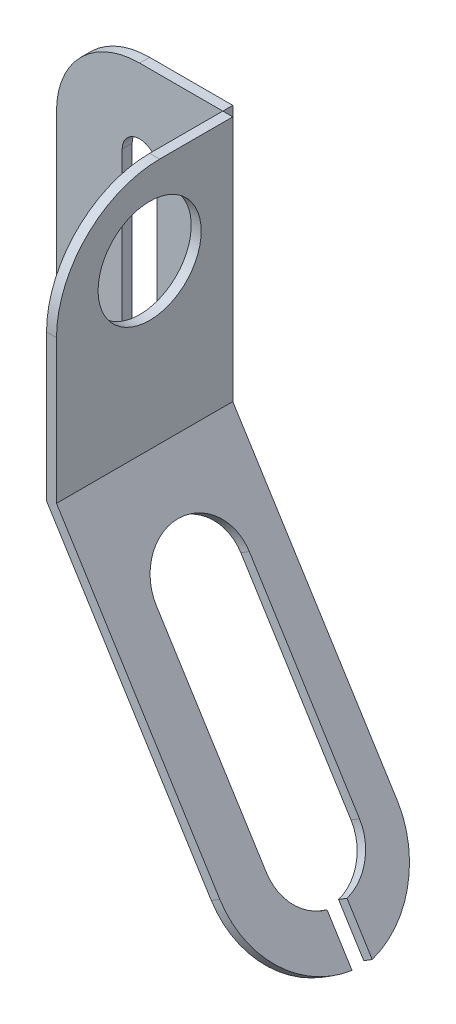
from build123d import *

# Parameters (mm, degrees)
BOSS_EXTRUDE1_DEPTH = 0.06
EXTRUDE_THIN2_DEPTH = 1.06
SKETCH4_R           = 0.31
CUT_EXTRUDE1_DEPTH  = 3.676216217
CUT_EXTRUDE2_DEPTH  = 3.676216217
CUT_EXTRUDE3_START  = -0.06
CUT_EXTRUDE3_DEPTH  = 0.06


# Read off the part's stored shape, not the designer's step: Cut-Extrude3
with BuildPart() as part:
    # Sketch2 → Boss-Extrude1 (new body)
    with BuildSketch(Plane.XY):
        with BuildLine():
            Line((0, 0), (0, 1.5))
            Line((0, 1.5), (-0.5, 1.5))
            ThreePointArc((-0.5, 1.5), (-0.853553391, 1.353553391), (-1, 1))
            Line((-1, 1), (-1, 0))
            Line((-1, 0), (-0.605, 0))
            Line((-0.605, 0), (-0.605, 1))
            ThreePointArc((-0.605, 1), (-0.5, 1.105), (-0.395, 1))
            Line((-0.395, 1), (-0.395, 0))
            Line((-0.395, 0), (0, 0))
        make_face()
    extrude(amount=-BOSS_EXTRUDE1_DEPTH)


with BuildPart() as body_2:
    # Sketch3 → Extrude-Thin2 (new body)
    with BuildSketch(Plane.XY):
        Polygon((0, 1.5), (0, 0), (1.287703812, -2.060756874), (1.338586698, -2.028961718), (0.06, 0.017204723), (0.06, 1.5), align=None)
    extrude(amount=EXTRUDE_THIN2_DEPTH)

    # Sketch4 → Cut-Extrude1 (cut, through all)
    with BuildSketch(Plane.ZY):
        with Locations((0.5, 1)):
            Circle(SKETCH4_R)
    extrude(amount=-CUT_EXTRUDE1_DEPTH, mode=Mode.SUBTRACT)

    # Sketch4<3> → Cut-Extrude2 (cut, through all)
    with BuildSketch(Plane.ZY):
        with BuildLine():
            ThreePointArc((0.44, 1.5), (0.878406204, 1.318406204), (1.06, 0.88))
            Line((1.06, 0.88), (1.06, 1.5))
            Line((1.06, 1.5), (0.44, 1.5))
        make_face()
    extrude(amount=-CUT_EXTRUDE2_DEPTH, mode=Mode.SUBTRACT)

    # Cut-Extrude3 outline → Cut-Extrude3 (cut)
    with BuildSketch(Plane(origin=(0, 0, 0), x_dir=(0, 0, 1), z_dir=(-0.8480480961564291, -0.5299192642332001, 0)).offset(CUT_EXTRUDE3_START)):
        with BuildLine():
            Line((0.44, -2.143495887), (0.44, -2.43))
            Line((0.44, -2.43), (1.06, -2.43))
            Line((1.06, -2.43), (1.06, -1.87))
            ThreePointArc((1.06, -1.87), (0.916653333, -2.244165739), (0.56, -2.426776436))
            Line((0.56, -2.426776436), (0.56, -2.143495887))
            ThreePointArc((0.56, -2.143495887), (0.718174242, -2.045499288), (0.78, -1.87))
            Line((0.78, -1.87), (0.78, -0.62))
            ThreePointArc((0.78, -0.62), (0.5, -0.34), (0.22, -0.62))
            Line((0.22, -0.62), (0.22, -1.87))
            ThreePointArc((0.22, -1.87), (0.281825758, -2.045499288), (0.44, -2.143495887))
        make_face()
        with BuildLine():
            ThreePointArc((0.44, -2.43), (0.127646005, -2.239065143), (0, -1.895950533))
            Line((0, -1.895950533), (0, -2.43))
            Line((0, -2.43), (0.44, -2.43))
        make_face()
    extrude(amount=CUT_EXTRUDE3_DEPTH, mode=Mode.SUBTRACT)


solid = Compound([part.part, body_2.part])
